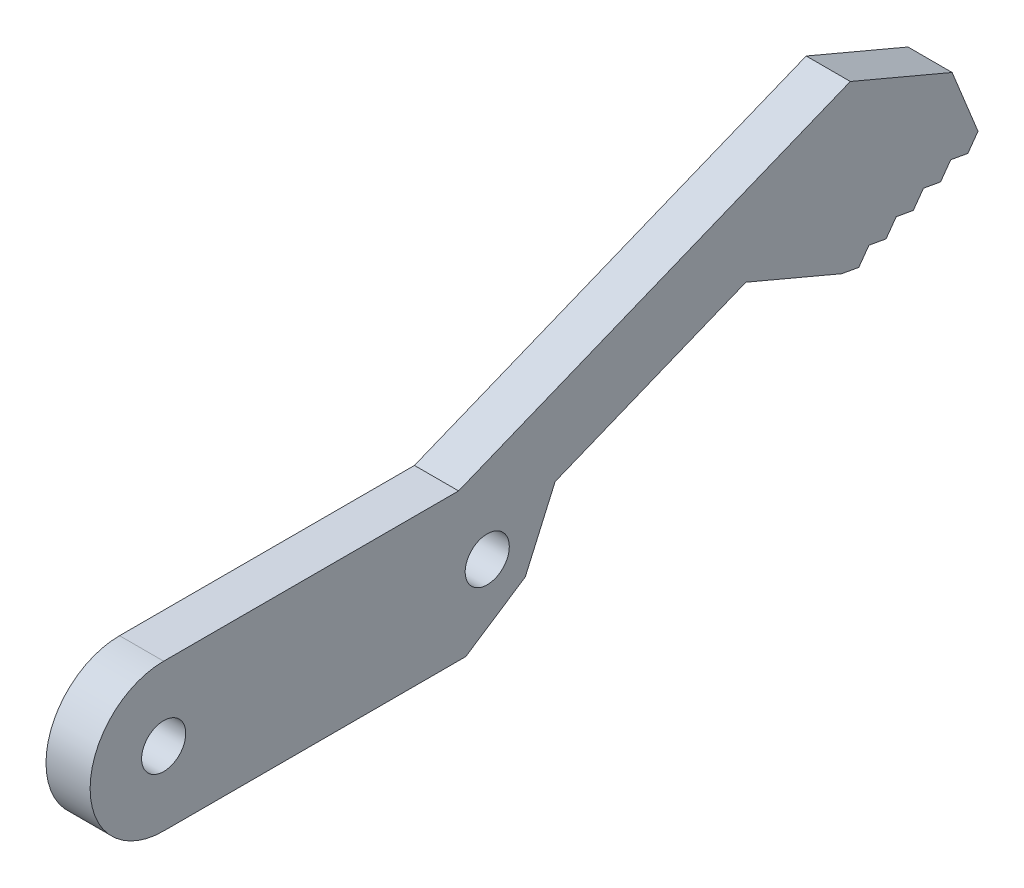
from build123d import *

# Parameters (mm, degrees)
SKETCH1_R             = 5
SKETCH1_R_2           = 1.5
BOSS_EXTRUDE1_DEPTH   = 3
BOSS_EXTRUDE2_START   = -3
BOSS_EXTRUDE2_DEPTH   = 3
CUT_EXTRUDE2_DEPTH    = 65.81382707
CORTAR_EXTRUIR1_DEPTH = 3
SCALE1_SCALE          = 0.888888889


# Read off the part's stored shape, not the designer's step: Cortar-Extruir1
with BuildPart() as part:
    # Sketch1 → Boss-Extrude1 (new body)
    # profile 1 of 3: a face of its own
    with BuildSketch(Plane(origin=(0, 0, 0), x_dir=(0, 0, -1), z_dir=(1, 0, 0))):
        with Locations((5, 5)):
            Circle(SKETCH1_R)
        with Locations((5, 5)):
            Circle(SKETCH1_R_2, mode=Mode.SUBTRACT)
    # profile 2 of 3: a face of its own
    with BuildSketch(Plane(origin=(0, 0, 0), x_dir=(0, 0, -1), z_dir=(1, 0, 0))):
        with BuildLine():
            ThreePointArc((10, 5), (8.535533906, 1.464466094), (5, 0))
            Line((5, 0), (27, 0))
            ThreePointArc((27, 0), (22, 5), (27, 10))
            Line((27, 10), (5, 10))
            ThreePointArc((5, 10), (8.535533906, 8.535533906), (10, 5))
        make_face()
    # profile 3 of 3: a face of its own
    with BuildSketch(Plane(origin=(0, 0, 0), x_dir=(0, 0, -1), z_dir=(1, 0, 0))):
        with Locations((27, 5)):
            Circle(SKETCH1_R)
        with Locations((27, 5)):
            Circle(SKETCH1_R_2, mode=Mode.SUBTRACT)
    extrude(amount=BOSS_EXTRUDE1_DEPTH)

    # Sketch2 → Boss-Extrude2 (add)
    with BuildSketch(Plane(origin=(3, 0, 0), x_dir=(0, 0, -1), z_dir=(1, 0, 0)).offset(BOSS_EXTRUDE2_START)):
        with BuildLine():
            ThreePointArc((27, 10), (29.694507461, 9.21184396), (31.53953799, 7.095851816))
            Line((31.53953799, 7.095851816), (31.610157793, 7.262674791))
            Line((31.610157793, 7.262674791), (44.585599673, 12.519851602))
            Line((44.585599673, 12.519851602), (51.097249205, 9.763328363))
            Line((51.097249205, 9.763328363), (60.365421977, 13.518454657))
            Line((60.365421977, 13.518454657), (56.610295683, 22.786627428))
            Line((56.610295683, 22.786627428), (25.051124858, 10))
            Line((25.051124858, 10), (27, 10))
        make_face()
        Polygon((60.365421977, 13.518454657), (51.097249205, 9.763328363), (51.333822162, 9.179433479), (60.601994933, 12.934559772), align=None)
    extrude(amount=BOSS_EXTRUDE2_DEPTH)

    # Sketch4 → Cut-Extrude2 (cut, through all)
    with BuildSketch(Plane(origin=(3, 0, 0), x_dir=(0, 0, -1), z_dir=(1, 0, 0))):
        Polygon((56.610295683, 22.786627428), (51.684261855, 20.790777803), (58.606145308, 17.8605936), align=None)
    extrude(amount=-CUT_EXTRUDE2_DEPTH, mode=Mode.SUBTRACT)

    # Cortar-Extruir1 outline → Cortar-Extruir1 (cut)
    with BuildSketch(Plane.YZ):
        with BuildLine():
            ThreePointArc((0, -27), (2.305492538, -31.21184396), (7.095851816, -31.53953799))
            Line((7.095851816, -31.53953799), (2.664871714, -29.583874941))
            Line((2.664871714, -29.583874941), (0, -25.53953799))
            Line((0, -25.53953799), (0, -27))
        make_face()
        Polygon((13.518454657, -60.365421977), (12.559047143, -59.675177656), (12.934559772, -60.601994933), align=None)
        Polygon((12.767429398, -58.511787422), (11.808021884, -57.821543102), (12.559047143, -59.675177656), align=None)
        Polygon((12.01640414, -56.658152868), (11.056996626, -55.967908548), (11.808021884, -57.821543102), align=None)
        Polygon((11.265378881, -54.804518314), (10.305971367, -54.114273993), (11.056996626, -55.967908548), align=None)
        Polygon((10.514353622, -52.95088376), (9.554946108, -52.260639439), (10.305971367, -54.114273993), align=None)
        Polygon((9.554946108, -52.260639439), (9.763328363, -51.097249205), (9.179433479, -51.333822162), align=None)
    extrude(amount=CORTAR_EXTRUIR1_DEPTH, mode=Mode.SUBTRACT)


with BuildPart() as part_1:
    # Scale1: scaled about (1.5, 8.912185075, -28.416581742)
    add(part.part.scale(SCALE1_SCALE).moved(Location((0.166666667, 0.990242786, -3.157397971))))


solid = part_1.part
